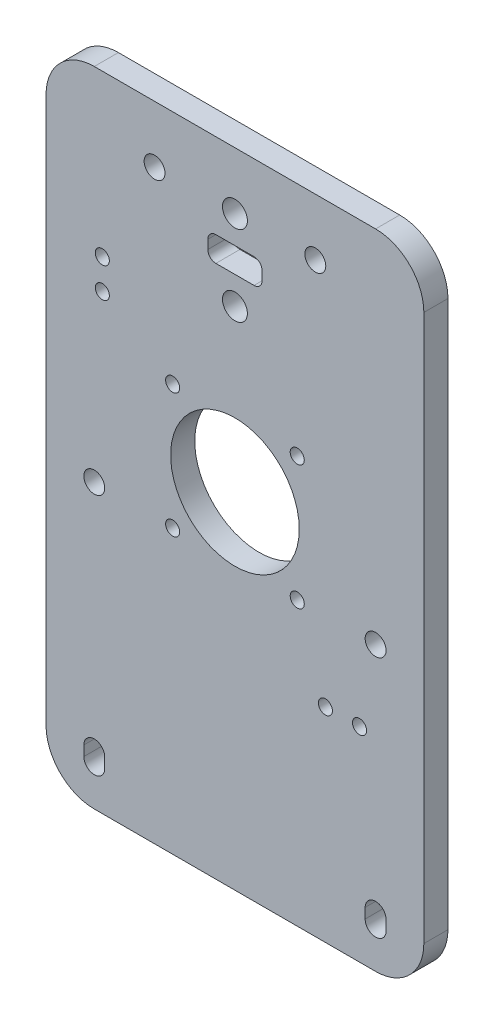
from build123d import *

# Parameters (mm, degrees)
MODEL_R                         = 2.6
MODEL_R_2                       = 16
MODEL_R_3                       = 3.1
MODEL_W                         = 13.5
MODEL_H                         = 6.2
BASE_DEPTH                      = 6
FILLETCABLESLOT_R               = 2
F_3_2_3_2_STEPPER_MOUNT_HOLES_D = 3.5
F_3_5_3_5_SENSORMOUNT_D         = 3.5
F_3_5_3_5_CABLEMOUNT_D          = 3.5


with BuildPart() as part:
    # Model → Base (new body)
    with BuildSketch(Plane.XY):
        with BuildLine():
            Line((35, 160), (-35, 160))
            ThreePointArc((-35, 160), (-43.485281374, 156.485281374), (-47, 148))
            Line((-47, 148), (-47, 12))
            ThreePointArc((-47, 12), (-43.485281374, 3.514718626), (-35, 0))
            Line((-35, 0), (35, 0))
            ThreePointArc((35, 0), (43.485281374, 3.514718626), (47, 12))
            Line((47, 12), (47, 148))
            ThreePointArc((47, 148), (43.485281374, 156.485281374), (35, 160))
        make_face()
        with BuildLine():
            ThreePointArc((-37.6, 12.5), (-35, 15.1), (-32.4, 12.5))
            Line((-32.4, 12.5), (-32.4, 10))
            ThreePointArc((-32.4, 10), (-35, 7.4), (-37.6, 10))
            Line((-37.6, 10), (-37.6, 12.5))
        make_face(mode=Mode.SUBTRACT)
        with Locations((-35, 70.45)):
            Circle(MODEL_R, mode=Mode.SUBTRACT)
        with BuildLine():
            Line((32.4, 10), (32.4, 12.5))
            ThreePointArc((32.4, 12.5), (35, 15.1), (37.6, 12.5))
            Line((37.6, 12.5), (37.6, 10))
            ThreePointArc((37.6, 10), (35, 7.4), (32.4, 10))
        make_face(mode=Mode.SUBTRACT)
        with Locations((35, 70.45)):
            Circle(MODEL_R, mode=Mode.SUBTRACT)
        with Locations((-20, 145.8)):
            Circle(MODEL_R, mode=Mode.SUBTRACT)
        with Locations((0, 85.8)):
            Circle(MODEL_R_2, mode=Mode.SUBTRACT)
        with Locations((0, 125.8)):
            Circle(MODEL_R_3, mode=Mode.SUBTRACT)
        with Locations((0, 135.8)):
            Rectangle(MODEL_W, MODEL_H, mode=Mode.SUBTRACT)
        with Locations((0, 145.8)):
            Circle(MODEL_R_3, mode=Mode.SUBTRACT)
        with Locations((20, 145.8)):
            Circle(MODEL_R, mode=Mode.SUBTRACT)
    extrude(amount=BASE_DEPTH)

    # FilletCableSlot
    filletcableslot_edges = [part.edges().sort_by_distance(p)[0] for p in [
        (6.75, 138.9, 3),
        (-6.75, 138.9, 3),
        (-6.75, 132.7, 3),
        (6.75, 132.7, 3),
    ]]
    fillet(filletcableslot_edges, radius=FILLETCABLESLOT_R)

    # Ø3.2 (3.2) Stepper mount Holes (through all)
    with Locations(Plane.XY.offset(6)):
        with Locations((-15.5, 101.3), (-15.5, 70.3), (15.5, 70.3), (15.5, 101.3)):
            Hole(F_3_2_3_2_STEPPER_MOUNT_HOLES_D / 2)

    # Ø3.5 (3.5) SensorMount (through all)
    with Locations(Plane.XY.offset(6)):
        with Locations((-33, 120), (-33, 112.5)):
            Hole(F_3_5_3_5_SENSORMOUNT_D / 2)

    # Ø3.5 (3.5) CableMount (through all)
    with Locations(Plane.XY.offset(6)):
        with Locations((22.5, 50.76), (31, 50.76)):
            Hole(F_3_5_3_5_CABLEMOUNT_D / 2)


solid = part.part
